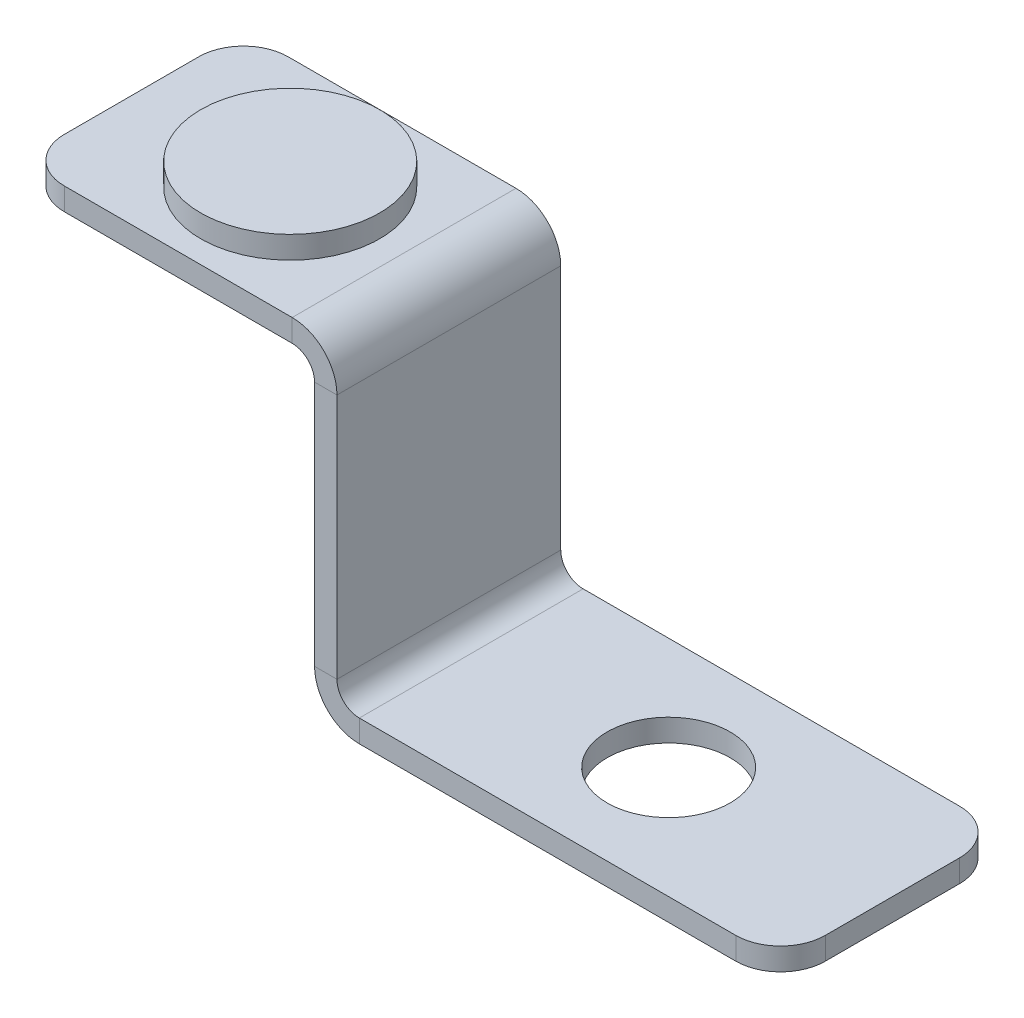
from build123d import *
from build123d.topology import SkipClean

# Parameters (mm, degrees)
SKETCH2_R           = 2.75
BASE_FLANGE1_DEPTH  = 1
JOG1_START          = -10
JOG1_DEPTH          = 10
JOG1_START_2        = -8
JOG1_2_DEPTH        = 6
JOG1_START_3        = 13
JOG1_3_DEPTH        = 1.976704963
JOG1_START_4        = 1
JOG1_4_OUTLINE_W    = 1
JOG1_4_OUTLINE_H    = 2
JOG1_4_DEPTH        = 12.160683996
JOG1_START_5        = 14
JOG1_5_DEPTH        = 1
JOG1_6_DEPTH        = 10
JOG1_7_DEPTH        = 10
SKETCH8_R           = 4
BOSS_EXTRUDE2_DEPTH = 1


with BuildPart() as part:
    # Base-Flange1: sheet metal written as solids
    # Sketch2 → Base-Flange1 (new body)
    with BuildSketch(Plane(origin=(0, 0, 0), x_dir=(1, 0, 0), z_dir=(0, 1, 0))):
        with BuildLine():
            Line((2, 0), (32, 0))
            ThreePointArc((32, 0), (33.414213562, 0.585786438), (34, 2))
            Line((34, 2), (34, 8))
            ThreePointArc((34, 8), (33.414213562, 9.414213562), (32, 10))
            Line((32, 10), (2, 10))
            ThreePointArc((2, 10), (0.585786438, 9.414213562), (0, 8))
            Line((0, 8), (0, 2))
            ThreePointArc((0, 2), (0.585786438, 0.585786438), (2, 0))
        make_face()
        with Locations(Location((24, 5, 0), (0, 0, 270))):
            Circle(SKETCH2_R, mode=Mode.SUBTRACT)
    extrude(amount=BASE_FLANGE1_DEPTH)

    # Jog1: read off the stored shape, not the designer's step
    # Jog1 outline → Jog1 (cut)
    with BuildSketch(Plane.XY.offset(JOG1_START)):
        with BuildLine():
            ThreePointArc((15.178097245, 0), (14.178097245, 0.267949193), (13.446046438, 1))
            Line((13.446046438, 1), (0, 1))
            Line((0, 1), (0, 0))
            Line((0, 0), (15.178097245, 0))
        make_face()
    extrude(amount=JOG1_DEPTH, mode=Mode.SUBTRACT)

    # Jog1 2 outline → Jog1 2 (add)
    with BuildSketch(Plane.XY.offset(JOG1_START_2)):
        with BuildLine():
            Line((14.178097245, 2), (14.178097245, 13))
            ThreePointArc((14.178097245, 13), (13.592310807, 14.414213562), (12.178097245, 15))
            Line((12.178097245, 15), (0, 15))
            Line((0, 15), (0, 14))
            Line((0, 14), (12.178097245, 14))
            ThreePointArc((12.178097245, 14), (12.885204026, 13.707106781), (13.178097245, 13))
            Line((13.178097245, 13), (13.178097245, 2))
            ThreePointArc((13.178097245, 2), (13.246245593, 1.48236191), (13.446046438, 1))
            Line((13.446046438, 1), (15.178097245, 1))
            ThreePointArc((15.178097245, 1), (14.470990464, 1.292893219), (14.178097245, 2))
        make_face()
    extrude(amount=JOG1_2_DEPTH)

    # Jog1 3 outline → Jog1 3 (add)
    with BuildSketch(Plane(origin=(0, 0, 0), x_dir=(1, 0, 0), z_dir=(0, 1, 0)).offset(JOG1_START_3)):
        with BuildLine():
            Line((14.178097245, 0), (14.178097245, 2))
            Line((14.178097245, 2), (0, 2))
            ThreePointArc((0, 2), (0.585786438, 0.585786438), (2, 0))
            Line((2, 0), (14.178097245, 0))
        make_face()
        with BuildLine():
            Line((14.178097245, 8), (14.178097245, 10))
            Line((14.178097245, 10), (2, 10))
            ThreePointArc((2, 10), (0.585786438, 9.414213562), (0, 8))
            Line((0, 8), (14.178097245, 8))
        make_face()
    extrude(amount=JOG1_3_DEPTH)

    # Jog1 4 outline → Jog1 4 (add)
    with BuildSketch(Plane(origin=(0, 0, 0), x_dir=(1, 0, 0), z_dir=(0, 1, 0)).offset(JOG1_START_4)):
        with Locations((13.678097245, 1)):
            Rectangle(JOG1_4_OUTLINE_W, JOG1_4_OUTLINE_H)
        with Locations((13.678097245, 9)):
            Rectangle(JOG1_4_OUTLINE_W, JOG1_4_OUTLINE_H)
    extrude(amount=JOG1_4_DEPTH)

    # Jog1 5 outline → Jog1 5 (add)
    with BuildSketch(Plane(origin=(0, 0, 0), x_dir=(1, 0, 0), z_dir=(0, 1, 0)).offset(JOG1_START_5)):
        with BuildLine():
            Line((2, 0), (13.178097245, 0))
            Line((13.178097245, 0), (13.178097245, 2))
            Line((13.178097245, 2), (0, 2))
            ThreePointArc((0, 2), (0.585786438, 0.585786438), (2, 0))
        make_face()
        with BuildLine():
            Line((0, 8), (13.178097245, 8))
            Line((13.178097245, 8), (13.178097245, 10))
            Line((13.178097245, 10), (2, 10))
            ThreePointArc((2, 10), (0.585786438, 9.414213562), (0, 8))
        make_face()
    extrude(amount=JOG1_5_DEPTH)

    # Jog1 6 outline → Jog1 6 (cut)
    with SkipClean():  # the faces are left unmerged after this step: merging them gives an invalid solid
        with BuildSketch(Plane.XY.offset(JOG1_START)):
            with BuildLine():
                Line((14.178097245, 13), (14.178097245, 14.976704963))
                Line((14.178097245, 14.976704963), (13.178097245, 14.976704963))
                Line((13.178097245, 14.976704963), (13.178097245, 15))
                Line((13.178097245, 15), (13.178097236, 16))
                Line((13.178097236, 16), (-1, 16))
                Line((-1, 16), (-1, 15.000000008))
                Line((-1, 15.000000008), (12.178097245, 15))
                ThreePointArc((12.178097245, 15), (13.592310807, 14.414213562), (14.178097245, 13))
            make_face()
            with BuildLine():
                Line((14.178097254, -1), (14.178097249, 0.267949191))
                ThreePointArc((14.178097249, 0.267949191), (13.763883685, 0.585786436), (13.446046438, 1))
                ThreePointArc((13.446046438, 1), (13.246245593, 1.48236191), (13.178097245, 2))
                Line((13.178097245, 2), (13.178097245, 13))
                ThreePointArc((13.178097245, 13), (12.885204026, 13.707106781), (12.178097245, 14))
                Line((12.178097245, 14), (-1, 14))
                Line((-1, 14), (-1, -1))
                Line((-1, -1), (14.178097254, -1))
            make_face()
        extrude(amount=JOG1_6_DEPTH, mode=Mode.SUBTRACT)
    add(part.part.scale(1), mode=Mode.REPLACE)  # the faces are merged on a copy

    # Jog1 7 outline → Jog1 7 (add)
    with SkipClean():  # the faces are left unmerged after this step: merging them gives an invalid solid
        with BuildSketch(Plane.XY.offset(JOG1_START)):
            with BuildLine():
                ThreePointArc((15.178097245, 1), (14.470990464, 1.292893219), (14.178097245, 2))
                Line((14.178097245, 2), (14.178097245, 1))
                Line((14.178097245, 1), (14.178097249, 0.267949191))
                ThreePointArc((14.178097249, 0.267949191), (14.660459157, 0.068148347), (15.178097245, 0))
                Line((15.178097245, 0), (17, -1e-09))
                Line((17, -1e-09), (17, 0.999999999))
                Line((17, 0.999999999), (15.178097245, 1))
            make_face()
        extrude(amount=JOG1_7_DEPTH)
    add(part.part.scale(1), mode=Mode.REPLACE)  # the faces are merged on a copy


with BuildPart() as body_2:
    # Sketch8 → Boss-Extrude2 (new body)
    with BuildSketch(Plane(origin=(0, 15, 0), x_dir=(1, 0, 0), z_dir=(0, 1, 0))):
        with Locations(Location((7.089048623, 5, 0), (0, 0, 180))):
            Circle(SKETCH8_R)
    extrude(amount=BOSS_EXTRUDE2_DEPTH)


solid = Compound([part.part, body_2.part])
